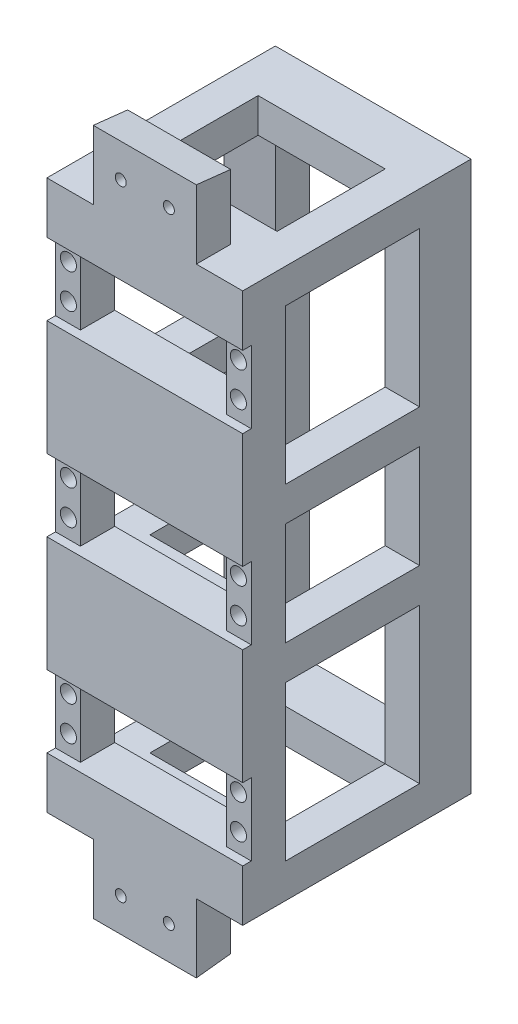
from build123d import *

# Parameters (mm, degrees)
SKETCH1_W           = 57
SKETCH1_H           = 160
BOSS_EXTRUDE1_DEPTH = 33.25
SKETCH2_W           = 42.5
SKETCH2_H           = 21
CUT_EXTRUDE1_DEPTH  = 51.5
SKETCH3_W           = 31.5
SKETCH3_H           = 45
SKETCH3_H_2         = 30
CUT_EXTRUDE2_DEPTH  = 104.704206761
SKETCH4_W           = 37
SKETCH4_H           = 140
CUT_EXTRUDE3_DEPTH  = 100.320189287
SKETCH5_W           = 57
SKETCH5_H           = 21
CUT_EXTRUDE4_DEPTH  = 2.5
SKETCH37_W          = 39
SKETCH37_H          = 45
SKETCH37_H_2        = 30
CUT_EXTRUDE10_DEPTH = 104.704206761
CUT_EXTRUDE6_REACH  = 108.34
SKETCH6_R           = 2.35
SKETCH8_W           = 37
SKETCH8_H           = 31.5
CUT_EXTRUDE7_DEPTH  = 166.884937532
BOSS_EXTRUDE3_REACH = 167.885
SKETCH11_W          = 30
SKETCH11_H          = 10
BOSS_EXTRUDE4_REACH = 187.251
SKETCH13_W          = 30
SKETCH13_H          = 10
CUT_EXTRUDE9_REACH  = 125.428
SKETCH12_R          = 1.6
CHAMFER1_SIZE       = 10
CHAMFER1_SIZE_2     = 5


with BuildPart() as part:
    # Sketch1 → Boss-Extrude1 (new, symmetric)
    with BuildSketch(Plane.XY):
        Rectangle(SKETCH1_W, SKETCH1_H)
    extrude(amount=BOSS_EXTRUDE1_DEPTH, both=True)

    # Sketch2 → Cut-Extrude1 (cut)
    with BuildSketch(Plane.XY.offset(33.25)):
        with Locations((0, 54.5)):
            Rectangle(SKETCH2_W, SKETCH2_H)
        Rectangle(SKETCH2_W, SKETCH2_H)
        with Locations((0, -54.5)):
            Rectangle(SKETCH2_W, SKETCH2_H)
    extrude(amount=-CUT_EXTRUDE1_DEPTH, mode=Mode.SUBTRACT)

    # Sketch3 → Cut-Extrude2 (cut, through all)
    with BuildSketch(Plane.ZY.offset(28.5)):
        with Locations((-2.5, -47.5)):
            Rectangle(SKETCH3_W, SKETCH3_H)
        with Locations((-2.5, 0)):
            Rectangle(SKETCH3_W, SKETCH3_H_2)
        with Locations((-2.5, 47.5)):
            Rectangle(SKETCH3_W, SKETCH3_H)
    extrude(amount=-CUT_EXTRUDE2_DEPTH, mode=Mode.SUBTRACT)

    # Sketch4 → Cut-Extrude3 (cut, through all)
    with BuildSketch(Plane.XY.offset(-18.25)):
        Rectangle(SKETCH4_W, SKETCH4_H)
    extrude(amount=-CUT_EXTRUDE3_DEPTH, mode=Mode.SUBTRACT)

    # Sketch5 → Cut-Extrude4 (cut)
    with BuildSketch(Plane.XY.offset(33.25)):
        Rectangle(SKETCH5_W, SKETCH5_H)
        with Locations((0, 54.5)):
            Rectangle(SKETCH5_W, SKETCH5_H)
        with Locations((0, -54.5)):
            Rectangle(SKETCH5_W, SKETCH5_H)
    extrude(amount=-CUT_EXTRUDE4_DEPTH, mode=Mode.SUBTRACT)

    # Sketch37 → Cut-Extrude10 (cut, through all)
    with BuildSketch(Plane.ZY.offset(28.5)):
        with Locations((1.25, 47.5)):
            Rectangle(SKETCH37_W, SKETCH37_H)
        with Locations((1.25, 0)):
            Rectangle(SKETCH37_W, SKETCH37_H_2)
        with Locations((1.25, -47.5)):
            Rectangle(SKETCH37_W, SKETCH37_H)
    extrude(amount=-CUT_EXTRUDE10_DEPTH, mode=Mode.SUBTRACT)

    # Sketch6 → Cut-Extrude6 (cut, up to next)
    with BuildSketch(Plane.XY.offset(30.75), mode=Mode.PRIVATE) as cut_extrude6_sk1:
        with Locations((24.75, 5)):
            Circle(SKETCH6_R)
    cut_extrude6_tool1 = extrude(cut_extrude6_sk1.sketch, amount=-CUT_EXTRUDE6_REACH, mode=Mode.PRIVATE) & part.part
    # Sketch6 → Cut-Extrude6 (cut, up to next)
    with BuildSketch(Plane.XY.offset(30.75), mode=Mode.PRIVATE) as cut_extrude6_sk2:
        with Locations(Location((-24.75, 5, 0), (0, 0, 270))):
            Circle(SKETCH6_R)
    cut_extrude6_tool2 = extrude(cut_extrude6_sk2.sketch, amount=-CUT_EXTRUDE6_REACH, mode=Mode.PRIVATE) & part.part
    # Sketch6 → Cut-Extrude6 (cut, up to next)
    with BuildSketch(Plane.XY.offset(30.75), mode=Mode.PRIVATE) as cut_extrude6_sk3:
        with Locations((-24.75, -5)):
            Circle(SKETCH6_R)
    cut_extrude6_tool3 = extrude(cut_extrude6_sk3.sketch, amount=-CUT_EXTRUDE6_REACH, mode=Mode.PRIVATE) & part.part
    # Sketch6 → Cut-Extrude6 (cut, up to next)
    with BuildSketch(Plane.XY.offset(30.75), mode=Mode.PRIVATE) as cut_extrude6_sk4:
        with Locations(Location((24.75, -5, 0), (0, 0, 270))):
            Circle(SKETCH6_R)
    cut_extrude6_tool4 = extrude(cut_extrude6_sk4.sketch, amount=-CUT_EXTRUDE6_REACH, mode=Mode.PRIVATE) & part.part
    # Sketch6 → Cut-Extrude6 (cut, up to next)
    with BuildSketch(Plane.XY.offset(30.75), mode=Mode.PRIVATE) as cut_extrude6_sk5:
        with Locations((24.75, 59.5)):
            Circle(SKETCH6_R)
    cut_extrude6_tool5 = extrude(cut_extrude6_sk5.sketch, amount=-CUT_EXTRUDE6_REACH, mode=Mode.PRIVATE) & part.part
    # Sketch6 → Cut-Extrude6 (cut, up to next)
    with BuildSketch(Plane.XY.offset(30.75), mode=Mode.PRIVATE) as cut_extrude6_sk6:
        with Locations(Location((-24.75, 59.5, 0), (0, 0, 270))):
            Circle(SKETCH6_R)
    cut_extrude6_tool6 = extrude(cut_extrude6_sk6.sketch, amount=-CUT_EXTRUDE6_REACH, mode=Mode.PRIVATE) & part.part
    # Sketch6 → Cut-Extrude6 (cut, up to next)
    with BuildSketch(Plane.XY.offset(30.75), mode=Mode.PRIVATE) as cut_extrude6_sk7:
        with Locations((-24.75, 49.5)):
            Circle(SKETCH6_R)
    cut_extrude6_tool7 = extrude(cut_extrude6_sk7.sketch, amount=-CUT_EXTRUDE6_REACH, mode=Mode.PRIVATE) & part.part
    # Sketch6 → Cut-Extrude6 (cut, up to next)
    with BuildSketch(Plane.XY.offset(30.75), mode=Mode.PRIVATE) as cut_extrude6_sk8:
        with Locations(Location((24.75, 49.5, 0), (0, 0, 270))):
            Circle(SKETCH6_R)
    cut_extrude6_tool8 = extrude(cut_extrude6_sk8.sketch, amount=-CUT_EXTRUDE6_REACH, mode=Mode.PRIVATE) & part.part
    # Sketch6 → Cut-Extrude6 (cut, up to next)
    with BuildSketch(Plane.XY.offset(30.75), mode=Mode.PRIVATE) as cut_extrude6_sk9:
        with Locations((24.75, -49.5)):
            Circle(SKETCH6_R)
    cut_extrude6_tool9 = extrude(cut_extrude6_sk9.sketch, amount=-CUT_EXTRUDE6_REACH, mode=Mode.PRIVATE) & part.part
    # Sketch6 → Cut-Extrude6 (cut, up to next)
    with BuildSketch(Plane.XY.offset(30.75), mode=Mode.PRIVATE) as cut_extrude6_sk10:
        with Locations((-24.75, -49.5)):
            Circle(SKETCH6_R)
    cut_extrude6_tool10 = extrude(cut_extrude6_sk10.sketch, amount=-CUT_EXTRUDE6_REACH, mode=Mode.PRIVATE) & part.part
    # Sketch6 → Cut-Extrude6 (cut, up to next)
    with BuildSketch(Plane.XY.offset(30.75), mode=Mode.PRIVATE) as cut_extrude6_sk11:
        with Locations((-24.75, -59.5)):
            Circle(SKETCH6_R)
    cut_extrude6_tool11 = extrude(cut_extrude6_sk11.sketch, amount=-CUT_EXTRUDE6_REACH, mode=Mode.PRIVATE) & part.part
    # Sketch6 → Cut-Extrude6 (cut, up to next)
    with BuildSketch(Plane.XY.offset(30.75), mode=Mode.PRIVATE) as cut_extrude6_sk12:
        with Locations((24.75, -59.5)):
            Circle(SKETCH6_R)
    cut_extrude6_tool12 = extrude(cut_extrude6_sk12.sketch, amount=-CUT_EXTRUDE6_REACH, mode=Mode.PRIVATE) & part.part
    add(cut_extrude6_tool1.solids().sort_by_distance((24.75, 5, 30.75))[0], mode=Mode.SUBTRACT)
    add(cut_extrude6_tool2.solids().sort_by_distance((-24.75, 5, 30.75))[0], mode=Mode.SUBTRACT)
    add(cut_extrude6_tool3.solids().sort_by_distance((-24.75, -5, 30.75))[0], mode=Mode.SUBTRACT)
    add(cut_extrude6_tool4.solids().sort_by_distance((24.75, -5, 30.75))[0], mode=Mode.SUBTRACT)
    add(cut_extrude6_tool5.solids().sort_by_distance((24.75, 59.5, 30.75))[0], mode=Mode.SUBTRACT)
    add(cut_extrude6_tool6.solids().sort_by_distance((-24.75, 59.5, 30.75))[0], mode=Mode.SUBTRACT)
    add(cut_extrude6_tool7.solids().sort_by_distance((-24.75, 49.5, 30.75))[0], mode=Mode.SUBTRACT)
    add(cut_extrude6_tool8.solids().sort_by_distance((24.75, 49.5, 30.75))[0], mode=Mode.SUBTRACT)
    add(cut_extrude6_tool9.solids().sort_by_distance((24.75, -49.5, 30.75))[0], mode=Mode.SUBTRACT)
    add(cut_extrude6_tool10.solids().sort_by_distance((-24.75, -49.5, 30.75))[0], mode=Mode.SUBTRACT)
    add(cut_extrude6_tool11.solids().sort_by_distance((-24.75, -59.5, 30.75))[0], mode=Mode.SUBTRACT)
    add(cut_extrude6_tool12.solids().sort_by_distance((24.75, -59.5, 30.75))[0], mode=Mode.SUBTRACT)

    # Sketch8 → Cut-Extrude7 (cut, through all)
    with BuildSketch(Plane(origin=(0, 80, 0), x_dir=(1, 0, 0), z_dir=(0, 1, 0))):
        with Locations((0, 2.5)):
            Rectangle(SKETCH8_W, SKETCH8_H)
    extrude(amount=-CUT_EXTRUDE7_DEPTH, mode=Mode.SUBTRACT)

    # Boss-Extrude3: up to this plane
    boss_extrude3_end = Plane(origin=(39, -90, -56.75), z_dir=(0, -0.9938837346736189, -0.1104315260748466))
    # Sketch11 → Boss-Extrude3 (add, up to the surface)
    with BuildSketch(Plane.XZ.offset(80), mode=Mode.PRIVATE) as boss_extrude3_sk1:
        with Locations((0, 28.25)):
            Rectangle(SKETCH11_W, SKETCH11_H)
    boss_extrude3_tool1 = split(extrude(boss_extrude3_sk1.sketch, amount=BOSS_EXTRUDE3_REACH, mode=Mode.PRIVATE), bisect_by=boss_extrude3_end, keep=Keep.BOTH, mode=Mode.PRIVATE)
    add(boss_extrude3_tool1.solids().sort_by_distance((0, -80, 28.25))[0])

    # Boss-Extrude4: up to this plane
    boss_extrude4_end = Plane(origin=(39, 90, -56.75), z_dir=(0, 0.9938837346736189, -0.1104315260748466))
    # Sketch13 → Boss-Extrude4 (add, up to the surface)
    with BuildSketch(Plane(origin=(0, 80, 0), x_dir=(1, 0, 0), z_dir=(0, 1, 0)), mode=Mode.PRIVATE) as boss_extrude4_sk1:
        with Locations((0, -28.25)):
            Rectangle(SKETCH13_W, SKETCH13_H)
    boss_extrude4_tool1 = split(extrude(boss_extrude4_sk1.sketch, amount=BOSS_EXTRUDE4_REACH, mode=Mode.PRIVATE), bisect_by=boss_extrude4_end, keep=Keep.BOTH, mode=Mode.PRIVATE)
    add(boss_extrude4_tool1.solids().sort_by_distance((0, 80, 28.25))[0])

    # Sketch12 → Cut-Extrude9 (cut, up to next)
    with BuildSketch(Plane.XY.offset(33.25), mode=Mode.PRIVATE) as cut_extrude9_sk1:
        with Locations((7, -90.25)):
            Circle(SKETCH12_R)
    cut_extrude9_tool1 = extrude(cut_extrude9_sk1.sketch, amount=-CUT_EXTRUDE9_REACH, mode=Mode.PRIVATE) & part.part
    # Sketch12 → Cut-Extrude9 (cut, up to next)
    with BuildSketch(Plane.XY.offset(33.25), mode=Mode.PRIVATE) as cut_extrude9_sk2:
        with Locations((7, 90.25)):
            Circle(SKETCH12_R)
    cut_extrude9_tool2 = extrude(cut_extrude9_sk2.sketch, amount=-CUT_EXTRUDE9_REACH, mode=Mode.PRIVATE) & part.part
    # Sketch12 → Cut-Extrude9 (cut, up to next)
    with BuildSketch(Plane.XY.offset(33.25), mode=Mode.PRIVATE) as cut_extrude9_sk3:
        with Locations((-7, -90.25)):
            Circle(SKETCH12_R)
    cut_extrude9_tool3 = extrude(cut_extrude9_sk3.sketch, amount=-CUT_EXTRUDE9_REACH, mode=Mode.PRIVATE) & part.part
    # Sketch12 → Cut-Extrude9 (cut, up to next)
    with BuildSketch(Plane.XY.offset(33.25), mode=Mode.PRIVATE) as cut_extrude9_sk4:
        with Locations((-7, 90.25)):
            Circle(SKETCH12_R)
    cut_extrude9_tool4 = extrude(cut_extrude9_sk4.sketch, amount=-CUT_EXTRUDE9_REACH, mode=Mode.PRIVATE) & part.part
    add(cut_extrude9_tool1.solids().sort_by_distance((7, -90.25, 33.25))[0], mode=Mode.SUBTRACT)
    add(cut_extrude9_tool2.solids().sort_by_distance((7, 90.25, 33.25))[0], mode=Mode.SUBTRACT)
    add(cut_extrude9_tool3.solids().sort_by_distance((-7, -90.25, 33.25))[0], mode=Mode.SUBTRACT)
    add(cut_extrude9_tool4.solids().sort_by_distance((-7, 90.25, 33.25))[0], mode=Mode.SUBTRACT)

    # Chamfer1
    # the kernel refuses this chamfer: 10, 5 mm, written as the material it adds along each edge
    # the kernel refuses this chamfer: 10, 5 mm, written as the material it takes off along each edge
    with BuildSketch(Plane(origin=(-18.5, 70, -18.25), x_dir=(-0.9998508956747119, 0, 0.01726807512366821), z_dir=(0, -1, 0)), Plane(origin=(-18.5, -25, -18.25), x_dir=(-0.9998508956747119, 0, 0.01726807512366821), z_dir=(0, -1, 0))) as chamfer1_2_piece_1:
        Polygon((CHAMFER1_SIZE * 0.999850895675, CHAMFER1_SIZE * 0.0172680751237), (-CHAMFER1_SIZE_2 * 0.0172680751237, CHAMFER1_SIZE_2 * 0.999850895675), (0, 0), align=None)
    extrude(amount=45, mode=Mode.SUBTRACT)
    with BuildSketch(Plane(origin=(-18.5, 95.898288738, -18.25), x_dir=(-0.9998508956747119, 0, 0.01726807512366821), z_dir=(0, -1, 0))) as chamfer1_2_piece_2_section:
        Polygon((CHAMFER1_SIZE * 0.999850895675, CHAMFER1_SIZE * 0.0172680751237), (-CHAMFER1_SIZE_2 * 0.0172680751237, CHAMFER1_SIZE_2 * 0.999850895675), (0, 0), align=None)
    chamfer1_2_piece_2 = extrude(amount=96.796577476, mode=Mode.PRIVATE)
    chamfer1_2_piece_2 = split(chamfer1_2_piece_2, bisect_by=Plane(origin=(-21.833333333, 15, -19.916666667), z_dir=(0, -1, 0)), keep=Keep.TOP, mode=Mode.PRIVATE)
    add(chamfer1_2_piece_2, mode=Mode.SUBTRACT)
    with BuildSketch(Plane(origin=(-18.5, 0.898288738, -18.25), x_dir=(-0.9998508956747119, 0, 0.01726807512366821), z_dir=(0, -1, 0))) as chamfer1_2_piece_3_section:
        Polygon((CHAMFER1_SIZE * 0.999850895675, CHAMFER1_SIZE * 0.0172680751237), (-CHAMFER1_SIZE_2 * 0.0172680751237, CHAMFER1_SIZE_2 * 0.999850895675), (0, 0), align=None)
    chamfer1_2_piece_3 = extrude(amount=96.796577476, mode=Mode.PRIVATE)
    chamfer1_2_piece_3 = split(chamfer1_2_piece_3, bisect_by=Plane(origin=(-21.833333333, -15, -19.916666667), z_dir=(0, 1, 0)), keep=Keep.TOP, mode=Mode.PRIVATE)
    add(chamfer1_2_piece_3, mode=Mode.SUBTRACT)
    with BuildSketch(Plane(origin=(-18.5, 40.898288738, -18.25), x_dir=(-0.9998508956747119, 0, 0.01726807512366821), z_dir=(0, -1, 0))) as chamfer1_2_piece_4_section:
        Polygon((CHAMFER1_SIZE * 0.999850895675, CHAMFER1_SIZE * 0.0172680751237), (-CHAMFER1_SIZE_2 * 0.0172680751237, CHAMFER1_SIZE_2 * 0.999850895675), (0, 0), align=None)
    chamfer1_2_piece_4 = extrude(amount=81.796577476, mode=Mode.PRIVATE)
    chamfer1_2_piece_4 = split(chamfer1_2_piece_4, bisect_by=Plane(origin=(-21.833333333, 25, -19.916666667), z_dir=(0, 1, 0)), keep=Keep.TOP, mode=Mode.PRIVATE)
    add(chamfer1_2_piece_4, mode=Mode.SUBTRACT)
    with BuildSketch(Plane(origin=(-18.5, 15, -18.25), x_dir=(-0.9998508956747119, 0, 0.01726807512366821), z_dir=(0, -1, 0))) as chamfer1_2_piece_5:
        Polygon((CHAMFER1_SIZE * 0.999850895675, CHAMFER1_SIZE * 0.0172680751237), (-CHAMFER1_SIZE_2 * 0.0172680751237, CHAMFER1_SIZE_2 * 0.999850895675), (0, 0), align=None)
    extrude(amount=30, mode=Mode.SUBTRACT)
    with BuildSketch(Plane(origin=(-18.5, 40.898288738, -18.25), x_dir=(-0.9998508956747119, 0, 0.01726807512366821), z_dir=(0, -1, 0))) as chamfer1_2_piece_6_section:
        Polygon((CHAMFER1_SIZE * 0.999850895675, CHAMFER1_SIZE * 0.0172680751237), (-CHAMFER1_SIZE_2 * 0.0172680751237, CHAMFER1_SIZE_2 * 0.999850895675), (0, 0), align=None)
    chamfer1_2_piece_6 = extrude(amount=81.796577476, mode=Mode.PRIVATE)
    chamfer1_2_piece_6 = split(chamfer1_2_piece_6, bisect_by=Plane(origin=(-21.833333333, -25, -19.916666667), z_dir=(0, -1, 0)), keep=Keep.TOP, mode=Mode.PRIVATE)
    add(chamfer1_2_piece_6, mode=Mode.SUBTRACT)


solid = part.part
